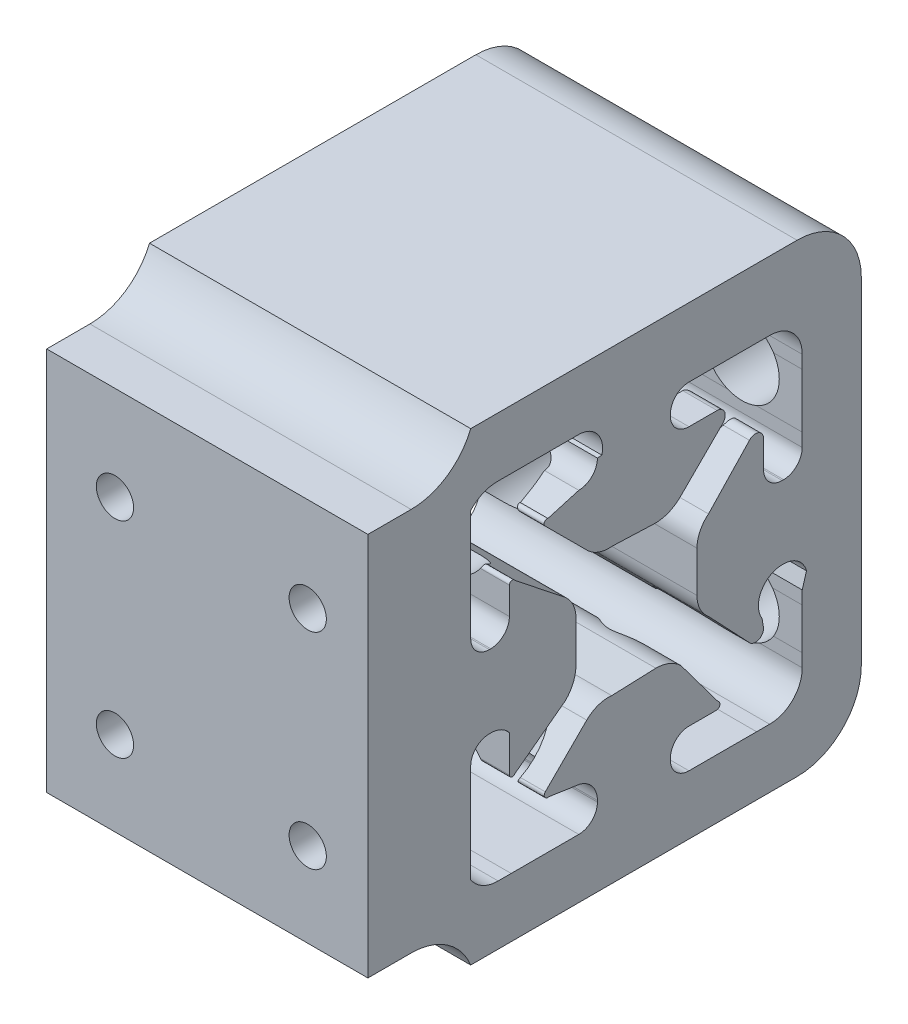
from build123d import *

# Parameters (mm, degrees)
SKETCH1_W                       = 25
SKETCH1_H                       = 29.9
SKETCH1_R                       = 2.9
BOSS_EXTRUDE1_DEPTH             = 5
BOSS_EXTRUDE2_REACH             = 22.595
BOSS_EXTRUDE2_DIRECTION_2_REACH = 22.595
FILLET1_R                       = 5
SKETCH5_R                       = 2.9
CUT_EXTRUDE1_DEPTH              = 42.928066076
SKETCH6_W                       = 25
SKETCH6_H                       = 29.9
SKETCH6_R                       = 1.45
BOSS_EXTRUDE3_DEPTH             = 3


with BuildPart() as part:
    # Sketch1 → Boss-Extrude1 (new body)
    with BuildSketch(Plane.XY):
        with Locations((-0.31541538, 0.377236794)):
            Rectangle(SKETCH1_W, SKETCH1_H)
        with Locations((-7.5, 8)):
            Circle(SKETCH1_R, mode=Mode.SUBTRACT)
        with Locations((7.5, 8)):
            Circle(SKETCH1_R, mode=Mode.SUBTRACT)
        with Locations((7.5, -8)):
            Circle(SKETCH1_R, mode=Mode.SUBTRACT)
        with Locations((-7.5, -8)):
            Circle(SKETCH1_R, mode=Mode.SUBTRACT)
    extrude(amount=BOSS_EXTRUDE1_DEPTH)

    # Boss-Extrude2: up to this face of the body (flat: up to its plane)
    boss_extrude2_end = Plane(part.part.faces().sort_by_distance((12.18458462, 0.377236794, 2.5))[0])
    # Sketch2 → Boss-Extrude2 (add, up to the picked face)
    with BuildSketch(Plane(origin=(0, 0, 0), x_dir=(0, 0, -1), z_dir=(1, 0, 0)), mode=Mode.PRIVATE) as boss_extrude2_sk1:
        with BuildLine():
            Line((0, 4.287469289), (0, -4.287469289))
            ThreePointArc((0, -4.287469289), (0.424405908, -3.26286279), (1.449012407, -2.838456882))
            Line((1.449012407, -2.838456882), (1.560787593, -2.838456882))
            ThreePointArc((1.560787593, -2.838456882), (2.365501583, -3.022752413), (3.0098, -3.538900647))
            Line((3.0098, -3.538900647), (3.0098, -6.402089023))
            ThreePointArc((3.0098, -6.402089023), (3.171298561, -6.619738526), (3.426414066, -6.528255355))
            Line((3.426414066, -6.528255355), (7.376475217, -3.557650358))
            ThreePointArc((7.376475217, -3.557650358), (7.97965784, -2.656598356), (8.1915, -1.593185507))
            Line((8.1915, -1.593185507), (8.1915, 1.593185507))
            ThreePointArc((8.1915, 1.593185507), (7.95471793, 2.626940355), (7.291584029, 3.45456845))
            Line((7.291584029, 3.45456845), (3.438412076, 6.508078976))
            ThreePointArc((3.438412076, 6.508078976), (3.182619705, 6.622850309), (3.0098, 6.402089023))
            Line((3.0098, 6.402089023), (3.0098, 4.287469289))
            ThreePointArc((3.0098, 4.287469289), (2.585394092, 3.26286279), (1.560787593, 2.838456882))
            Line((1.560787593, 2.838456882), (1.449012407, 2.838456882))
            ThreePointArc((1.449012407, 2.838456882), (0.424405908, 3.26286279), (0, 4.287469289))
        make_face()
    boss_extrude2_tool1 = split(extrude(boss_extrude2_sk1.sketch, amount=BOSS_EXTRUDE2_REACH, mode=Mode.PRIVATE), bisect_by=boss_extrude2_end, keep=Keep.BOTH, mode=Mode.PRIVATE)
    # Sketch2 → Boss-Extrude2 (add, up to the picked face)
    with BuildSketch(Plane(origin=(0, 0, 0), x_dir=(0, 0, -1), z_dir=(1, 0, 0)), mode=Mode.PRIVATE) as boss_extrude2_sk2:
        with BuildLine():
            Line((17.60848991, 1.593202094), (17.608483126, -1.59316892))
            ThreePointArc((17.608483126, -1.59316892), (17.844746203, -2.62585465), (18.506532875, -3.453077994))
            Line((18.506532875, -3.453077994), (21.695128991, -6.820369096))
            ThreePointArc((21.695128991, -6.820369096), (22.471676494, -6.948173988), (22.762177947, -6.216758223))
            Line((22.762177947, -6.216758223), (22.681700091, -5.683998477))
            ThreePointArc((22.681700091, -5.683998477), (22.617239478, -3.799701756), (24.239192883, -2.838454411))
            Line((24.239192883, -2.838454411), (24.350968068, -2.838454649))
            ThreePointArc((24.350968068, -2.838454649), (25.471034352, -3.216314587), (26.133313556, -4.195453427))
            Line((26.133313556, -4.195453427), (25.799975199, -5.317074692))
            Line((25.799975199, -5.317074692), (25.799997837, -6.33308775))
            Line((25.799997837, -6.33308775), (25.799999481, -9.550429917))
            Line((25.799999481, -9.550429917), (25.799847328, -10.564126169))
            ThreePointArc((25.799847328, -10.564126169), (25.065381858, -12.365348599), (23.264173201, -13.099847846))
            Line((23.264173201, -13.099847846), (22.250473138, -13.1))
            Line((22.250473138, -13.1), (16.987512407, -13.1))
            ThreePointArc((16.987512407, -13.1), (15.962905908, -12.675594092), (15.5385, -11.650987593))
            Line((15.5385, -11.650987593), (15.5385, -11.539212407))
            ThreePointArc((15.5385, -11.539212407), (15.962905908, -10.514605908), (16.987512407, -10.0902))
            Line((16.987512407, -10.0902), (19.116408329, -10.0902))
            ThreePointArc((19.116408329, -10.0902), (19.38809295, -9.87908259), (19.25062672, -9.563668371))
            Line((19.25062672, -9.563668371), (16.369685471, -5.706790908))
            ThreePointArc((16.369685471, -5.706790908), (15.470031519, -5.106550575), (14.409253557, -4.8958))
            Line((14.409253557, -4.8958), (10.975774635, -5.027824954))
            ThreePointArc((10.975774635, -5.027824954), (9.925576978, -5.145337842), (9.030314529, -5.706790908))
            Line((9.030314529, -5.706790908), (5.802934283, -8.928292916))
            ThreePointArc((5.802934283, -8.928292916), (5.759795632, -9.269646326), (6.079915642, -9.395766402))
            Line((6.079915642, -9.395766402), (8.504505016, -9.75686403))
            ThreePointArc((8.504505016, -9.75686403), (9.483642446, -10.419145319), (9.8615, -11.539212407))
            Line((9.8615, -11.539212407), (9.8615, -11.650987593))
            ThreePointArc((9.8615, -11.650987593), (9.437094092, -12.675594092), (8.412487593, -13.1))
            Line((8.412487593, -13.1), (3.149526862, -13.1))
            Line((3.149526862, -13.1), (2.135826799, -13.099847846))
            ThreePointArc((2.135826799, -13.099847846), (0.919780121, -12.8005837), (0, -11.950681893))
            Line((0, -11.950681893), (0, -17.7))
            Line((0, -17.7), (30.400003645, -17.7))
            Line((30.400003645, -17.7), (30.400003645, 18.454473589))
            Line((30.400003645, 18.454473589), (0, 18.454473589))
            Line((0, 18.454473589), (0, 15.327236794))
            Line((0, 15.327236794), (-0.494837453, 12.163454047))
            ThreePointArc((-0.494837453, 12.163454047), (0.559539683, 13.409425405), (2.129961286, 13.854320629))
            Line((2.129961286, 13.854320629), (3.149717116, 13.854473589))
            Line((3.149717116, 13.854473589), (8.412487593, 13.854473589))
            ThreePointArc((8.412487593, 13.854473589), (9.867006025, 13.147049116), (10.208539027, 11.566091032))
            Line((10.208539027, 11.566091032), (9.8615, 11.539212407))
            ThreePointArc((9.8615, 11.539212407), (9.437094092, 10.514605908), (8.412487593, 10.0902))
            Line((8.412487593, 10.0902), (6.009557991, 9.396666756))
            ThreePointArc((6.009557991, 9.396666756), (5.740252693, 9.293695982), (5.775482942, 9.007536667))
            Line((5.775482942, 9.007536667), (9.084246385, 5.706335149))
            ThreePointArc((9.084246385, 5.706335149), (9.979352718, 5.145190232), (11.029261036, 5.02775307))
            Line((11.029261036, 5.02775307), (14.135972232, 4.904519058))
            ThreePointArc((14.135972232, 4.904519058), (15.313783796, 5.06640935), (16.315753615, 5.706335149))
            Line((16.315753615, 5.706335149), (19.624517058, 9.007536667))
            ThreePointArc((19.624517058, 9.007536667), (19.762583073, 9.698542259), (19.176788598, 10.0902))
            Line((19.176788598, 10.0902), (16.987512407, 10.0902))
            ThreePointArc((16.987512407, 10.0902), (15.962905908, 10.514605908), (15.5385, 11.539212407))
            Line((15.5385, 11.539212407), (15.5385, 11.650987593))
            ThreePointArc((15.5385, 11.650987593), (15.962905908, 12.675594092), (16.987512407, 13.1))
            Line((16.987512407, 13.1), (22.250473138, 13.1))
            Line((22.250473138, 13.1), (23.264173201, 13.099847846))
            ThreePointArc((23.264173201, 13.099847846), (25.065381858, 12.365348599), (25.799847328, 10.564126169))
            Line((25.799847328, 10.564126169), (25.799999379, 9.550429917))
            Line((25.799999379, 9.550429917), (25.799997837, 6.333083689))
            Line((25.799997837, 6.333083689), (25.799997837, 5.317082283))
            Line((25.799997837, 5.317082283), (25.799995645, 4.287468437))
            ThreePointArc((25.799995645, 4.287468437), (25.375587556, 3.262862842), (24.350980153, 2.838459115))
            Line((24.350980153, 2.838459115), (24.239204968, 2.838459353))
            ThreePointArc((24.239204968, 2.838459353), (23.214599372, 3.262867442), (22.790195645, 4.287474845))
            Line((22.790195645, 4.287474845), (22.790200147, 6.402094579))
            ThreePointArc((22.790200147, 6.402094579), (22.386673272, 6.988202085), (21.69515803, 6.82038487))
            Line((21.69515803, 6.82038487), (18.506547577, 3.453107343))
            ThreePointArc((18.506547577, 3.453107343), (17.844757383, 2.625886818), (17.60848991, 1.593202094))
        make_face()
    boss_extrude2_tool2 = split(extrude(boss_extrude2_sk2.sketch, amount=BOSS_EXTRUDE2_REACH, mode=Mode.PRIVATE), bisect_by=boss_extrude2_end, keep=Keep.BOTH, mode=Mode.PRIVATE)
    add(boss_extrude2_tool1.solids().sort_by(Axis((0, -0.020672, -4.202093), (1, 0, 0)))[0])
    add(boss_extrude2_tool2.solids().sort_by(Axis((0, 0.536376, -17.937307), (1, 0, 0)))[0])

    # Boss-Extrude2 direction 2: up to this face of the body (flat: up to its plane)
    boss_extrude2_direction_2_end = Plane(part.part.faces().sort_by_distance((-12.81541538, 0.377236794, 2.5))[0])
    # Sketch2 → Boss-Extrude2 direction 2 (add, up to the picked face)
    with BuildSketch(Plane(origin=(0, 0, 0), x_dir=(0, 0, -1), z_dir=(1, 0, 0)), mode=Mode.PRIVATE) as boss_extrude2_direction_2_sk1:
        with BuildLine():
            Line((0, 4.287469289), (0, -4.287469289))
            ThreePointArc((0, -4.287469289), (0.424405908, -3.26286279), (1.449012407, -2.838456882))
            Line((1.449012407, -2.838456882), (1.560787593, -2.838456882))
            ThreePointArc((1.560787593, -2.838456882), (2.365501583, -3.022752413), (3.0098, -3.538900647))
            Line((3.0098, -3.538900647), (3.0098, -6.402089023))
            ThreePointArc((3.0098, -6.402089023), (3.171298561, -6.619738526), (3.426414066, -6.528255355))
            Line((3.426414066, -6.528255355), (7.376475217, -3.557650358))
            ThreePointArc((7.376475217, -3.557650358), (7.97965784, -2.656598356), (8.1915, -1.593185507))
            Line((8.1915, -1.593185507), (8.1915, 1.593185507))
            ThreePointArc((8.1915, 1.593185507), (7.95471793, 2.626940355), (7.291584029, 3.45456845))
            Line((7.291584029, 3.45456845), (3.438412076, 6.508078976))
            ThreePointArc((3.438412076, 6.508078976), (3.182619705, 6.622850309), (3.0098, 6.402089023))
            Line((3.0098, 6.402089023), (3.0098, 4.287469289))
            ThreePointArc((3.0098, 4.287469289), (2.585394092, 3.26286279), (1.560787593, 2.838456882))
            Line((1.560787593, 2.838456882), (1.449012407, 2.838456882))
            ThreePointArc((1.449012407, 2.838456882), (0.424405908, 3.26286279), (0, 4.287469289))
        make_face()
    boss_extrude2_direction_2_tool1 = split(extrude(boss_extrude2_direction_2_sk1.sketch, amount=-BOSS_EXTRUDE2_DIRECTION_2_REACH, mode=Mode.PRIVATE), bisect_by=boss_extrude2_direction_2_end, keep=Keep.BOTH, mode=Mode.PRIVATE)
    # Sketch2 → Boss-Extrude2 direction 2 (add, up to the picked face)
    with BuildSketch(Plane(origin=(0, 0, 0), x_dir=(0, 0, -1), z_dir=(1, 0, 0)), mode=Mode.PRIVATE) as boss_extrude2_direction_2_sk2:
        with BuildLine():
            Line((17.60848991, 1.593202094), (17.608483126, -1.59316892))
            ThreePointArc((17.608483126, -1.59316892), (17.844746203, -2.62585465), (18.506532875, -3.453077994))
            Line((18.506532875, -3.453077994), (21.695128991, -6.820369096))
            ThreePointArc((21.695128991, -6.820369096), (22.471676494, -6.948173988), (22.762177947, -6.216758223))
            Line((22.762177947, -6.216758223), (22.681700091, -5.683998477))
            ThreePointArc((22.681700091, -5.683998477), (22.617239478, -3.799701756), (24.239192883, -2.838454411))
            Line((24.239192883, -2.838454411), (24.350968068, -2.838454649))
            ThreePointArc((24.350968068, -2.838454649), (25.471034352, -3.216314587), (26.133313556, -4.195453427))
            Line((26.133313556, -4.195453427), (25.799975199, -5.317074692))
            Line((25.799975199, -5.317074692), (25.799997837, -6.33308775))
            Line((25.799997837, -6.33308775), (25.799999481, -9.550429917))
            Line((25.799999481, -9.550429917), (25.799847328, -10.564126169))
            ThreePointArc((25.799847328, -10.564126169), (25.065381858, -12.365348599), (23.264173201, -13.099847846))
            Line((23.264173201, -13.099847846), (22.250473138, -13.1))
            Line((22.250473138, -13.1), (16.987512407, -13.1))
            ThreePointArc((16.987512407, -13.1), (15.962905908, -12.675594092), (15.5385, -11.650987593))
            Line((15.5385, -11.650987593), (15.5385, -11.539212407))
            ThreePointArc((15.5385, -11.539212407), (15.962905908, -10.514605908), (16.987512407, -10.0902))
            Line((16.987512407, -10.0902), (19.116408329, -10.0902))
            ThreePointArc((19.116408329, -10.0902), (19.38809295, -9.87908259), (19.25062672, -9.563668371))
            Line((19.25062672, -9.563668371), (16.369685471, -5.706790908))
            ThreePointArc((16.369685471, -5.706790908), (15.470031519, -5.106550575), (14.409253557, -4.8958))
            Line((14.409253557, -4.8958), (10.975774635, -5.027824954))
            ThreePointArc((10.975774635, -5.027824954), (9.925576978, -5.145337842), (9.030314529, -5.706790908))
            Line((9.030314529, -5.706790908), (5.802934283, -8.928292916))
            ThreePointArc((5.802934283, -8.928292916), (5.759795632, -9.269646326), (6.079915642, -9.395766402))
            Line((6.079915642, -9.395766402), (8.504505016, -9.75686403))
            ThreePointArc((8.504505016, -9.75686403), (9.483642446, -10.419145319), (9.8615, -11.539212407))
            Line((9.8615, -11.539212407), (9.8615, -11.650987593))
            ThreePointArc((9.8615, -11.650987593), (9.437094092, -12.675594092), (8.412487593, -13.1))
            Line((8.412487593, -13.1), (3.149526862, -13.1))
            Line((3.149526862, -13.1), (2.135826799, -13.099847846))
            ThreePointArc((2.135826799, -13.099847846), (0.919780121, -12.8005837), (0, -11.950681893))
            Line((0, -11.950681893), (0, -17.7))
            Line((0, -17.7), (30.400003645, -17.7))
            Line((30.400003645, -17.7), (30.400003645, 18.454473589))
            Line((30.400003645, 18.454473589), (0, 18.454473589))
            Line((0, 18.454473589), (0, 15.327236794))
            Line((0, 15.327236794), (-0.494837453, 12.163454047))
            ThreePointArc((-0.494837453, 12.163454047), (0.559539683, 13.409425405), (2.129961286, 13.854320629))
            Line((2.129961286, 13.854320629), (3.149717116, 13.854473589))
            Line((3.149717116, 13.854473589), (8.412487593, 13.854473589))
            ThreePointArc((8.412487593, 13.854473589), (9.867006025, 13.147049116), (10.208539027, 11.566091032))
            Line((10.208539027, 11.566091032), (9.8615, 11.539212407))
            ThreePointArc((9.8615, 11.539212407), (9.437094092, 10.514605908), (8.412487593, 10.0902))
            Line((8.412487593, 10.0902), (6.009557991, 9.396666756))
            ThreePointArc((6.009557991, 9.396666756), (5.740252693, 9.293695982), (5.775482942, 9.007536667))
            Line((5.775482942, 9.007536667), (9.084246385, 5.706335149))
            ThreePointArc((9.084246385, 5.706335149), (9.979352718, 5.145190232), (11.029261036, 5.02775307))
            Line((11.029261036, 5.02775307), (14.135972232, 4.904519058))
            ThreePointArc((14.135972232, 4.904519058), (15.313783796, 5.06640935), (16.315753615, 5.706335149))
            Line((16.315753615, 5.706335149), (19.624517058, 9.007536667))
            ThreePointArc((19.624517058, 9.007536667), (19.762583073, 9.698542259), (19.176788598, 10.0902))
            Line((19.176788598, 10.0902), (16.987512407, 10.0902))
            ThreePointArc((16.987512407, 10.0902), (15.962905908, 10.514605908), (15.5385, 11.539212407))
            Line((15.5385, 11.539212407), (15.5385, 11.650987593))
            ThreePointArc((15.5385, 11.650987593), (15.962905908, 12.675594092), (16.987512407, 13.1))
            Line((16.987512407, 13.1), (22.250473138, 13.1))
            Line((22.250473138, 13.1), (23.264173201, 13.099847846))
            ThreePointArc((23.264173201, 13.099847846), (25.065381858, 12.365348599), (25.799847328, 10.564126169))
            Line((25.799847328, 10.564126169), (25.799999379, 9.550429917))
            Line((25.799999379, 9.550429917), (25.799997837, 6.333083689))
            Line((25.799997837, 6.333083689), (25.799997837, 5.317082283))
            Line((25.799997837, 5.317082283), (25.799995645, 4.287468437))
            ThreePointArc((25.799995645, 4.287468437), (25.375587556, 3.262862842), (24.350980153, 2.838459115))
            Line((24.350980153, 2.838459115), (24.239204968, 2.838459353))
            ThreePointArc((24.239204968, 2.838459353), (23.214599372, 3.262867442), (22.790195645, 4.287474845))
            Line((22.790195645, 4.287474845), (22.790200147, 6.402094579))
            ThreePointArc((22.790200147, 6.402094579), (22.386673272, 6.988202085), (21.69515803, 6.82038487))
            Line((21.69515803, 6.82038487), (18.506547577, 3.453107343))
            ThreePointArc((18.506547577, 3.453107343), (17.844757383, 2.625886818), (17.60848991, 1.593202094))
        make_face()
    boss_extrude2_direction_2_tool2 = split(extrude(boss_extrude2_direction_2_sk2.sketch, amount=-BOSS_EXTRUDE2_DIRECTION_2_REACH, mode=Mode.PRIVATE), bisect_by=boss_extrude2_direction_2_end, keep=Keep.BOTH, mode=Mode.PRIVATE)
    add(boss_extrude2_direction_2_tool1.solids().sort_by(Axis((0, -0.020672, -4.202093), (-1, 0, 0)))[0])
    add(boss_extrude2_direction_2_tool2.solids().sort_by(Axis((0, 0.536376, -17.937307), (-1, 0, 0)))[0])

    # Fillet1
    # the kernel refuses this fillet: 5 mm, written as the material it adds along each edge
    with BuildSketch(Plane(origin=(-12.81541538, -14.572763206, 0), x_dir=(0, 0, 1), z_dir=(1, 0, 0))) as fillet1_piece_1:
        with BuildLine():
            CenterArc((4.636028254, 5), FILLET1_R, 201.99666603, 68.00333397)
            Line((0, 3.127236794), (0, 0))
            Line((0, 0), (4.636028254, 0))
        make_face()
    extrude(amount=25)
    with BuildSketch(Plane(origin=(12.18458462, 15.327236794, 0), x_dir=(0, 1, 0), z_dir=(-1, 0, 0))) as fillet1_piece_2:
        with BuildLine():
            CenterArc((5, -4.636028254), FILLET1_R, 111.99666603, 68.00333397)
            Line((0, -4.636028254), (0, 0))
            Line((0, 0), (3.127236794, 0))
        make_face()
    extrude(amount=25)
    # the kernel refuses this fillet: 5 mm, written as the material it takes off along each edge
    with BuildSketch(Plane(origin=(24.68458462, -17.7, -30.400003645), x_dir=(0, 1, 0), z_dir=(-1, 0, 0)), Plane(origin=(24.68458462, 18.454473589, -30.400003645), x_dir=(0, 0, 1), z_dir=(-1, 0, 0))) as fillet1_2_piece_1:
        with BuildLine():
            CenterArc((FILLET1_R, -FILLET1_R), FILLET1_R, 90, 90)
            Line((0, -FILLET1_R), (0, 0))
            Line((0, 0), (FILLET1_R, 0))
        make_face()
    extrude(amount=50, mode=Mode.SUBTRACT)

    # Sketch5 → Cut-Extrude1 (cut, through all)
    with BuildSketch(Plane.XY.offset(5)):
        with Locations((-7.5, -8)):
            Circle(SKETCH5_R)
        with Locations((7.5, -8)):
            Circle(SKETCH5_R)
        with Locations((7.5, 8)):
            Circle(SKETCH5_R)
        with Locations((-7.5, 8)):
            Circle(SKETCH5_R)
    extrude(amount=-CUT_EXTRUDE1_DEPTH, mode=Mode.SUBTRACT)

    # Sketch6 → Boss-Extrude3 (add)
    with BuildSketch(Plane.XY.offset(5)):
        with Locations((-0.31541538, 0.377236794)):
            Rectangle(SKETCH6_W, SKETCH6_H)
        with Locations((-7.5, 8)):
            Circle(SKETCH6_R, mode=Mode.SUBTRACT)
        with Locations((7.5, 8)):
            Circle(SKETCH6_R, mode=Mode.SUBTRACT)
        with Locations((7.5, -8)):
            Circle(SKETCH6_R, mode=Mode.SUBTRACT)
        with Locations((-7.5, -8)):
            Circle(SKETCH6_R, mode=Mode.SUBTRACT)
    extrude(amount=BOSS_EXTRUDE3_DEPTH)


solid = part.part
